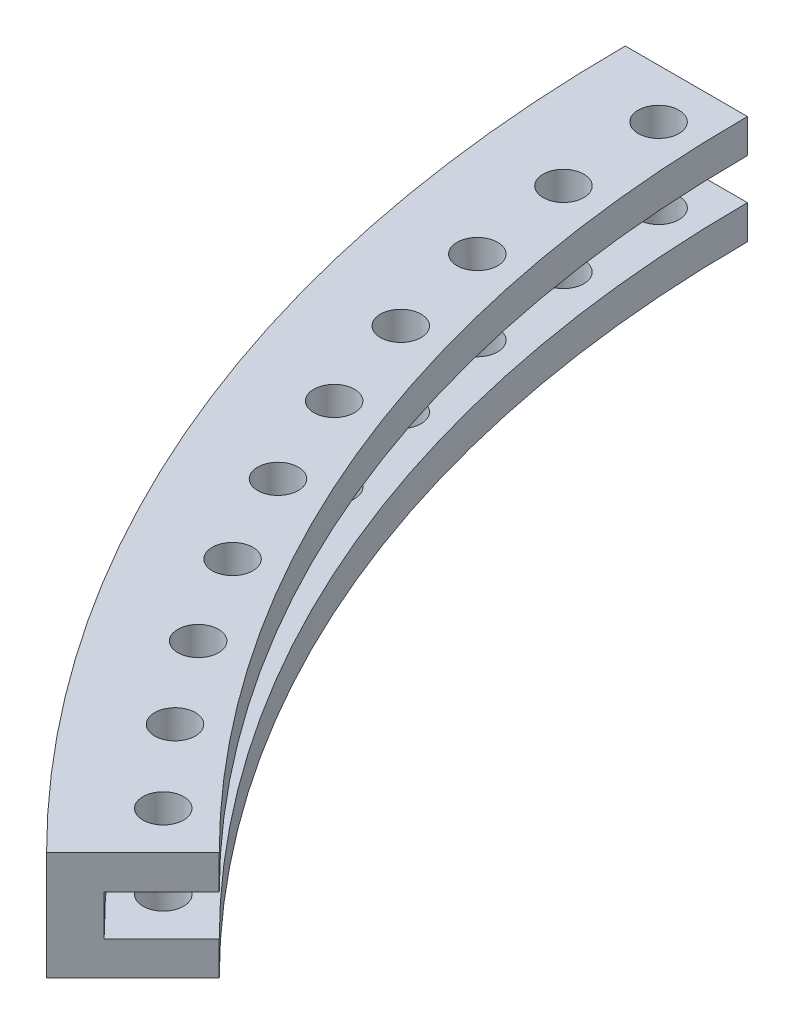
from build123d import *

# Parameters (mm, degrees)
R_VOLUTION1_ANGLE            = 45
ESQUISSE3_R                  = 1.5
ENL_V_MAT_EXTRU_1_DEPTH      = 127.402136058
R_P_TITION_CIRCULAIRE1_COUNT = 10
R_P_TITION_CIRCULAIRE1_ANGLE = 40.5


with BuildPart() as part:
    # Esquisse2 → Révolution1 (revolve)
    with BuildSketch(Plane.XY):
        Polygon((-103, 4), (-103, -4), (-94, -4), (-94, -1.5), (-100, -1.5), (-100, 1.5), (-94, 1.5), (-94, 4), align=None)
    revolve(axis=Axis((0, -55, 0), (0, 1, 0)), revolution_arc=R_VOLUTION1_ANGLE)

    # Esquisse3 → Enlèv. mat.-Extru.1 (cut, through all)
    with BuildSketch(Plane(origin=(0, 4, 0), x_dir=(1, 0, 0), z_dir=(0, 1, 0))):
        with Locations((-71.359442001, -65.702587752)):
            Circle(ESQUISSE3_R)
    enl_v_mat_extru_1 = extrude(amount=-ENL_V_MAT_EXTRU_1_DEPTH, mode=Mode.SUBTRACT)

    # Répétition circulaire1: Enlèv. mat.-Extru.1 ×10 about axis
    r_p_tition_circulaire1_axis = Axis((0, -55, 0), (0, -1, 0))
    for i in range(1, R_P_TITION_CIRCULAIRE1_COUNT):
        add(enl_v_mat_extru_1.rotate(r_p_tition_circulaire1_axis, i * R_P_TITION_CIRCULAIRE1_ANGLE / (R_P_TITION_CIRCULAIRE1_COUNT - 1)), mode=Mode.SUBTRACT)


solid = part.part
